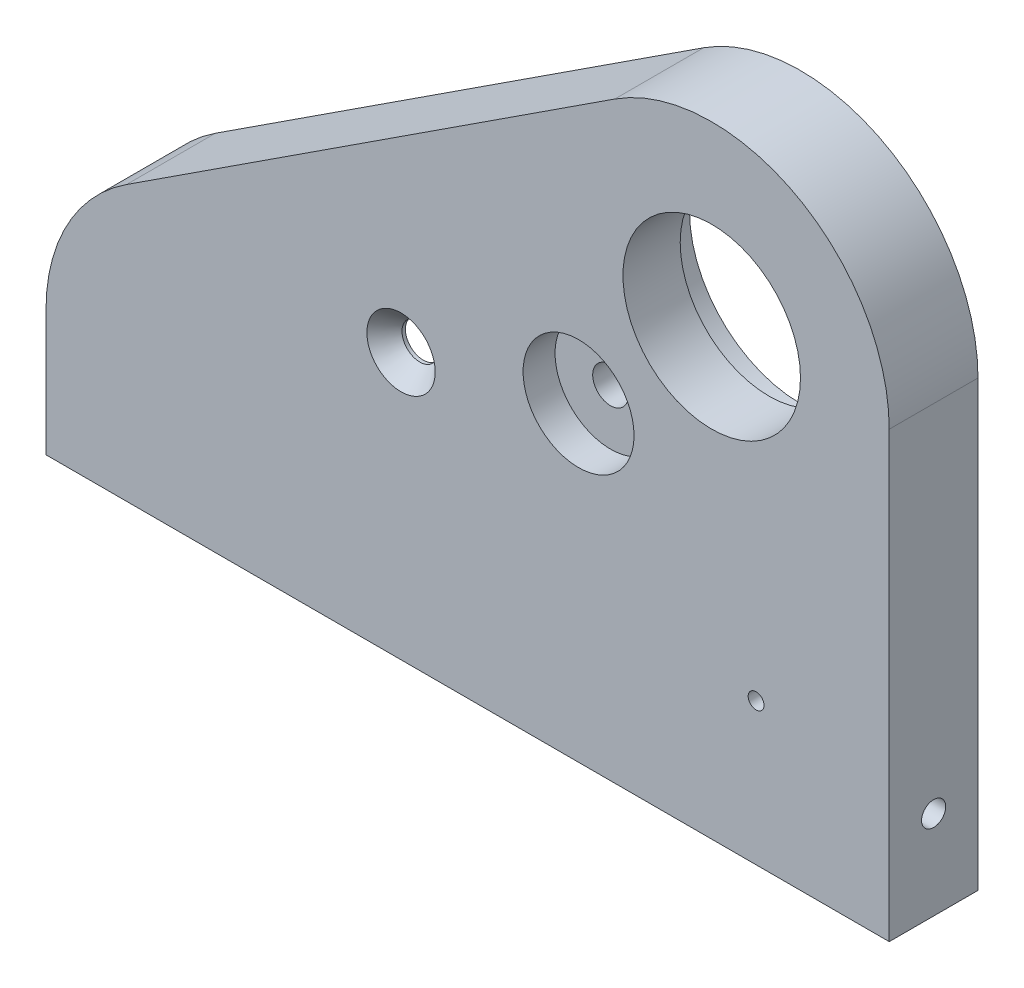
from build123d import *

# Parameters (mm, degrees)
BOSS_EXTRUDE1_DEPTH                             = 6.35
SKETCH4_R                                       = 12.7
CUT_EXTRUDE3_DEPTH                              = 116.178567885
SKETCH5_R                                       = 15.875
CUT_EXTRUDE4_DEPTH                              = 4.5085
FILLET1_R                                       = 25.4
F_8_32_TAPPED_HOLE2_D                           = 3.4544
F_8_32_TAPPED_HOLE2_DEPTH                       = 10.668
F_8_32_TAPPED_HOLE2_TIP                         = 1.037806461
F_1_4_20_TAPPED_HOLE1_D                         = 5.1054
SKETCH27_R                                      = 7.9375
CUT_EXTRUDE6_DEPTH                              = 4.572
CUT_EXTRUDE8_START                              = -9.525
CUT_EXTRUDE8_DEPTH                              = 9.525
FILLET2_R                                       = 6.35
F_8_32_TAPPED_HOLE1_D                           = 3.4544
F_8_32_TAPPED_HOLE1_DEPTH                       = 10.668
F_8_32_TAPPED_HOLE1_TIP                         = 1.037806461
F_4_40_TAPPED_HOLE1_D                           = 2.2606
F_4_40_TAPPED_HOLE1_DEPTH                       = 7.62
F_4_40_TAPPED_HOLE1_TIP                         = 0.679152758
CSK_FOR_10_FLAT_HEAD_MACHINE_SCREW1_D           = 5.1054
CSK_FOR_10_FLAT_HEAD_MACHINE_SCREW1_CSINK_D     = 9.779
CSK_FOR_10_FLAT_HEAD_MACHINE_SCREW1_CSINK_ANGLE = 82


with BuildPart() as part:
    # Sketch1 → Boss-Extrude1 (new, symmetric)
    with BuildSketch(Plane.XY):
        with BuildLine():
            Line((25.4, 0), (25.4, -63.5))
            Line((25.4, -63.5), (-95.25, -63.5))
            Line((-95.25, -63.5), (-95.25, -31.75))
            Line((-95.25, -31.75), (-13.866905739, 21.280717216))
            ThreePointArc((-13.866905739, 21.280717216), (12.10249136, 22.33136142), (25.4, 0))
        make_face()
    extrude(amount=BOSS_EXTRUDE1_DEPTH, both=True)

    # Sketch4 → Cut-Extrude3 (cut, through all)
    with BuildSketch(Plane.XY.offset(6.35)):
        Circle(SKETCH4_R)
    extrude(amount=-CUT_EXTRUDE3_DEPTH, mode=Mode.SUBTRACT)

    # Sketch5 → Cut-Extrude4 (cut)
    with BuildSketch(Plane(origin=(0, 0, -6.35), x_dir=(-1, 0, 0), z_dir=(0, 0, -1))):
        Circle(SKETCH5_R)
    extrude(amount=-CUT_EXTRUDE4_DEPTH, mode=Mode.SUBTRACT)

    # Fillet1
    fillet1_edges = [part.edges().sort_by_distance(p)[0] for p in [
        (-95.25, -31.75, 0),
    ]]
    fillet(fillet1_edges, radius=FILLET1_R)

    # #8-32 Tapped Hole2
    with Locations(Plane(origin=(25.4, 0, 0), x_dir=(0, 0, -1), z_dir=(1, 0, 0))):
        with Locations((0, -50.8)):
            Hole(F_8_32_TAPPED_HOLE2_D / 2, depth=F_8_32_TAPPED_HOLE2_DEPTH)
            with Locations((0, 0, -(F_8_32_TAPPED_HOLE2_DEPTH + F_8_32_TAPPED_HOLE2_TIP / 2))):  # 118° drill point
                Cone(0, F_8_32_TAPPED_HOLE2_D / 2, F_8_32_TAPPED_HOLE2_TIP, mode=Mode.SUBTRACT)

    # 1/4-20 Tapped Hole1 (through all)
    with Locations(Plane.XY.offset(6.35)):
        with Locations((-19.05, -19.05)):
            Hole(F_1_4_20_TAPPED_HOLE1_D / 2)

    # Sketch27 → Cut-Extrude6 (cut)
    with BuildSketch(Plane.XY.offset(6.35)):
        with Locations((-19.05, -19.05)):
            Circle(SKETCH27_R)
    extrude(amount=-CUT_EXTRUDE6_DEPTH, mode=Mode.SUBTRACT)

    # Sketch28 → Cut-Extrude8 (cut)
    with BuildSketch(Plane(origin=(0, 0, -6.35), x_dir=(-1, 0, 0), z_dir=(0, 0, -1)).offset(CUT_EXTRUDE8_START)):
        with BuildLine():
            ThreePointArc((5.38883143, -24.821774631), (-7.920985408, -24.133337734), (-19.05, -16.800520825))
            Line((-19.05, -16.800520825), (-19.05, -57.15))
            Line((-19.05, -57.15), (88.9, -57.15))
            Line((88.9, -57.15), (88.9, -45.515541418))
            ThreePointArc((88.9, -45.515541418), (86.598521065, -36.438672898), (80.250179304, -29.555003506))
            Line((80.250179304, -29.555003506), (48.206868735, -8.674994495))
            ThreePointArc((48.206868735, -8.674994495), (35.288934952, -8.113746603), (28.574321085, -19.163722759))
            ThreePointArc((28.574321085, -19.163722759), (23.199392186, -27.623690541), (13.229821608, -26.589970059))
            ThreePointArc((13.229821608, -26.589970059), (9.504977418, -24.838266448), (5.38883143, -24.821774631))
        make_face()
    extrude(amount=CUT_EXTRUDE8_DEPTH, mode=Mode.SUBTRACT)

    # Fillet2
    # the kernel refuses this fillet: 6.35 mm, written as the material it adds along each edge
    with BuildSketch(Plane(origin=(19.05, -57.15, 3.175), x_dir=(0, 1, 0), z_dir=(0, 0, -1))) as fillet2_piece_1_section:
        with BuildLine():
            CenterArc((FILLET2_R, -FILLET2_R), FILLET2_R, 90, 90)
            Line((0, -FILLET2_R), (0, 0))
            Line((0, 0), (FILLET2_R, 0))
        make_face()
    fillet2_piece_1 = extrude(amount=9.525, mode=Mode.PRIVATE)
    fillet2_piece_1 = fillet2_piece_1 - Plane(origin=(17.599243773, -50.8, 0), x_dir=(0, 0, 1), z_dir=(-1, 0, 0)) * Cylinder(1.7272, 45, mode=Mode.PRIVATE)
    add(fillet2_piece_1)
    with BuildSketch(Plane(origin=(-88.9, -57.15, 3.175), x_dir=(1, 0, 0), z_dir=(0, 0, -1))) as fillet2_piece_2:
        with BuildLine():
            CenterArc((FILLET2_R, -FILLET2_R), FILLET2_R, 90, 90)
            Line((0, -FILLET2_R), (0, 0))
            Line((0, 0), (FILLET2_R, 0))
        make_face()
    extrude(amount=9.525)
    with BuildSketch(Plane(origin=(19.05, -16.800520825, 3.175), x_dir=(-0.8081515274529607, -0.5889746248145555, 0), z_dir=(0, 0, -1))) as fillet2_piece_3:
        with BuildLine():
            CenterArc((12.375463834, -6.199333292), FILLET2_R, 102.506099706, 113.578178478)
            Line((7.243701634, -9.93932216), (0, 0))
            ThreePointArc((0, 0), (5.500206148, -0.60266683), (11.000412296, 0))
        make_face()
    extrude(amount=9.525)

    # #8-32 Tapped Hole1
    with Locations(Plane.XZ.offset(63.5)):
        with Locations((12.7, 0), (-34.925, 0), (-82.55, 0)):
            Hole(F_8_32_TAPPED_HOLE1_D / 2, depth=F_8_32_TAPPED_HOLE1_DEPTH)
            with Locations((0, 0, -(F_8_32_TAPPED_HOLE1_DEPTH + F_8_32_TAPPED_HOLE1_TIP / 2))):  # 118° drill point
                Cone(0, F_8_32_TAPPED_HOLE1_D / 2, F_8_32_TAPPED_HOLE1_TIP, mode=Mode.SUBTRACT)

    # #4-40 Tapped Hole1
    with Locations(Plane(origin=(0, 0, 3.175), x_dir=(-1, 0, 0), z_dir=(0, 0, -1))):
        with Locations((-6.35, -43.18)):
            Hole(F_4_40_TAPPED_HOLE1_D / 2, depth=F_4_40_TAPPED_HOLE1_DEPTH)
            with Locations((0, 0, -(F_4_40_TAPPED_HOLE1_DEPTH + F_4_40_TAPPED_HOLE1_TIP / 2))):  # 118° drill point
                Cone(0, F_4_40_TAPPED_HOLE1_D / 2, F_4_40_TAPPED_HOLE1_TIP, mode=Mode.SUBTRACT)

    # CSK for #10 Flat Head Machine Screw1 (through all)
    with Locations(Plane.XY.offset(6.35)):
        with Locations((-44.45, -25.4)):
            CounterSinkHole(CSK_FOR_10_FLAT_HEAD_MACHINE_SCREW1_D / 2, CSK_FOR_10_FLAT_HEAD_MACHINE_SCREW1_CSINK_D / 2, counter_sink_angle=CSK_FOR_10_FLAT_HEAD_MACHINE_SCREW1_CSINK_ANGLE)


solid = part.part
